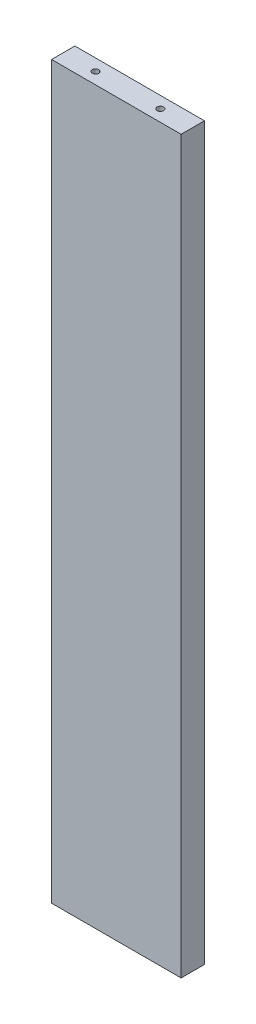
from build123d import *

# Parameters (mm, degrees)
SKETCH_1_W            = 100
SKETCH_1_H            = 564
EXTRUDE_5906_DEPTH    = 18
SKETCH_11_R           = 2.5
CUT_EXTRUDE_1_DEPTH   = 37
SKETCH_12_R           = 2.5
CUT_EXTRUDE_2_DEPTH   = 37
CUT_EXTRUDE_START     = -37
SKETCH_19_R           = 2.5
CUT_EXTRUDE_1_2_DEPTH = 37
SKETCH_20_R           = 2.5
CUT_EXTRUDE_2_2_DEPTH = 37


with BuildPart() as part:
    # Эскиз1 → Extrude 5906 (new body)
    with BuildSketch(Plane.XY):
        with Locations((50, 282)):
            Rectangle(SKETCH_1_W, SKETCH_1_H)
    extrude(amount=EXTRUDE_5906_DEPTH)

    # Эскиз11 → Cut-Extrude 1 (cut)
    with BuildSketch(Plane(origin=(0, 564, 0), x_dir=(1, 0, 0), z_dir=(0, 1, 0))):
        with Locations((25, -9)):
            Circle(SKETCH_11_R)
    extrude(amount=-CUT_EXTRUDE_1_DEPTH, mode=Mode.SUBTRACT)

    # Эскиз12 → Cut-Extrude 2 (cut)
    with BuildSketch(Plane(origin=(0, 564, 0), x_dir=(1, 0, 0), z_dir=(0, 1, 0))):
        with Locations((75, -9)):
            Circle(SKETCH_12_R)
    extrude(amount=-CUT_EXTRUDE_2_DEPTH, mode=Mode.SUBTRACT)

    # Эскиз19 → Cut-Extrude 1 2 (cut)
    with BuildSketch(Plane.XZ.offset(CUT_EXTRUDE_START)):
        with Locations((75, 9)):
            Circle(SKETCH_19_R)
    extrude(amount=CUT_EXTRUDE_1_2_DEPTH, mode=Mode.SUBTRACT)

    # Эскиз20 → Cut-Extrude 2 2 (cut)
    with BuildSketch(Plane.XZ.offset(CUT_EXTRUDE_START)):
        with Locations((25, 9)):
            Circle(SKETCH_20_R)
    extrude(amount=CUT_EXTRUDE_2_2_DEPTH, mode=Mode.SUBTRACT)


solid = part.part
